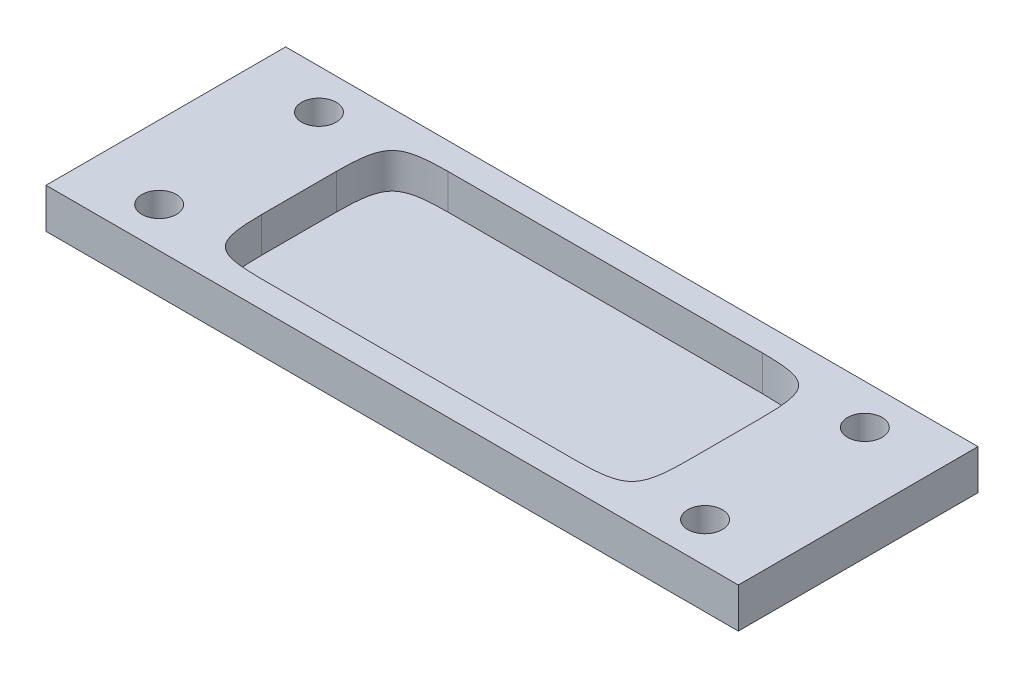
from build123d import *

# Parameters (mm, degrees)
SKETCH1_W                  = 52
SKETCH1_H                  = 18
BOSS_EXTRUDE1_DEPTH        = 3
SKETCH2_W                  = 32
SKETCH2_H                  = 14
CUT_EXTRUDE1_DEPTH         = 2.65
FILLET1_SIZE               = 4.2
F_2_6_2_6_DIAMETER_HOLE1_D = 2.6


with BuildPart() as part:
    # Sketch1 → Boss-Extrude1 (new body)
    with BuildSketch(Plane(origin=(0, 0, 0), x_dir=(1, 0, 0), z_dir=(0, 1, 0))):
        Rectangle(SKETCH1_W, SKETCH1_H)
    extrude(amount=BOSS_EXTRUDE1_DEPTH)

    # Sketch2 → Cut-Extrude1 (cut)
    with BuildSketch(Plane(origin=(0, 3, 0), x_dir=(1, 0, 0), z_dir=(0, 1, 0))):
        Rectangle(SKETCH2_W, SKETCH2_H)
    extrude(amount=-CUT_EXTRUDE1_DEPTH, mode=Mode.SUBTRACT)

    # Fillet1
    # a fillet whose section is not a circle: 4.2 mm, written as the material it adds along each edge
    with BuildSketch(Plane(origin=(16, 3, 7), x_dir=(0, 0, -1), z_dir=(0, -1, 0)), Plane(origin=(-16, 3, 7), x_dir=(1, 0, 0), z_dir=(0, -1, 0)), Plane(origin=(16, 3, -7), x_dir=(-1, 0, 0), z_dir=(0, -1, 0))) as fillet1_piece_1:
        with BuildLine():
            Bezier((FILLET1_SIZE, 0), (0, 0), (0, -FILLET1_SIZE), weights=[1, 1.857142857, 1])
            Line((0, -FILLET1_SIZE), (-FILLET1_SIZE * 0.02, -FILLET1_SIZE))
            Line((-FILLET1_SIZE * 0.02, -FILLET1_SIZE), (-FILLET1_SIZE * 0.02, FILLET1_SIZE * 0.02))
            Line((-FILLET1_SIZE * 0.02, FILLET1_SIZE * 0.02), (FILLET1_SIZE, FILLET1_SIZE * 0.02))
            Line((FILLET1_SIZE, FILLET1_SIZE * 0.02), (FILLET1_SIZE, 0))
        make_face()
    extrude(amount=2.65)
    with BuildSketch(Plane(origin=(-16, 3, -7), x_dir=(1, 0, 0), z_dir=(0, -1, 0))) as fillet1_piece_2:
        with BuildLine():
            Bezier((FILLET1_SIZE, 0), (0, 0), (0, FILLET1_SIZE), weights=[1, 1.857142857, 1])
            Line((0, FILLET1_SIZE), (-FILLET1_SIZE * 0.02, FILLET1_SIZE))
            Line((-FILLET1_SIZE * 0.02, FILLET1_SIZE), (-FILLET1_SIZE * 0.02, -FILLET1_SIZE * 0.02))
            Line((-FILLET1_SIZE * 0.02, -FILLET1_SIZE * 0.02), (FILLET1_SIZE, -FILLET1_SIZE * 0.02))
            Line((FILLET1_SIZE, -FILLET1_SIZE * 0.02), (FILLET1_SIZE, 0))
        make_face()
    extrude(amount=2.65)

    # Ø2.6 (2.6) Diameter Hole1 (through all)
    with Locations(Plane(origin=(0, 3, 0), x_dir=(1, 0, 0), z_dir=(0, 1, 0))):
        with Locations((-20.5, 6), (-20.5, -6), (20.5, 6), (20.5, -6)):
            Hole(F_2_6_2_6_DIAMETER_HOLE1_D / 2)


solid = part.part
